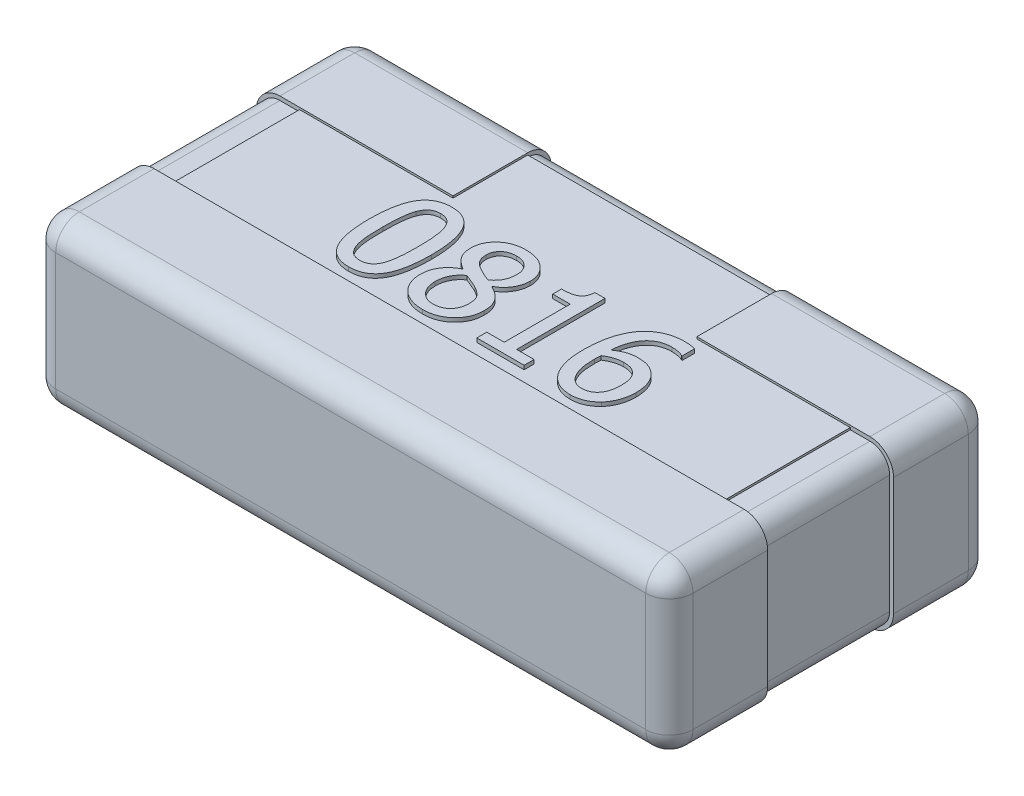
from build123d import *

# Parameters (mm, degrees)
SKETCH1_W           = 1.6
SKETCH1_H           = 0.8
BOSS_EXTRUDE1_DEPTH = 0.4
SKETCH2_W           = 1.62
SKETCH2_H           = 0.25
SKETCH2_W_2         = 0.5
BOSS_EXTRUDE2_DEPTH = 0.01
SKETCH3_W           = 1.62
SKETCH3_H           = 0.25
SKETCH3_W_2         = 0.5
BOSS_EXTRUDE3_DEPTH = 0.41
SKETCH4_W           = 1.4
SKETCH4_H           = 0.51
BOSS_EXTRUDE4_DEPTH = 0.005
FILLET1_R           = 0.05
FILLET2_R           = 0.06
WRAP1_DEPTH         = 0.01


# Read off the part's stored shape, not the designer's step: Wrap1
with BuildPart() as part:
    # Sketch1 → Boss-Extrude1 (new body)
    with BuildSketch(Plane(origin=(0, 0, 0), x_dir=(1, 0, 0), z_dir=(0, 1, 0))):
        Rectangle(SKETCH1_W, SKETCH1_H)
    extrude(amount=BOSS_EXTRUDE1_DEPTH)

    # Sketch2 → Boss-Extrude2 (add)
    with BuildSketch(Plane.XZ):
        with Locations((0, 0.285)):
            Rectangle(SKETCH2_W, SKETCH2_H)
        with Locations((0.56, -0.285)):
            Rectangle(SKETCH2_W_2, SKETCH2_H)
        with Locations((-0.56, -0.285)):
            Rectangle(SKETCH2_W_2, SKETCH2_H)
    extrude(amount=BOSS_EXTRUDE2_DEPTH)

    # Sketch3 → Boss-Extrude3 (add)
    with BuildSketch(Plane.XZ):
        with Locations((0, 0.285)):
            Rectangle(SKETCH3_W, SKETCH3_H)
        with Locations((-0.56, -0.285)):
            Rectangle(SKETCH3_W_2, SKETCH3_H)
        with Locations((0.56, -0.285)):
            Rectangle(SKETCH3_W_2, SKETCH3_H)
    extrude(amount=-BOSS_EXTRUDE3_DEPTH)

    # Sketch4 → Boss-Extrude4 (add)
    with BuildSketch(Plane(origin=(0, 0.4, 0), x_dir=(1, 0, 0), z_dir=(0, 1, 0))):
        with Locations((0, 0.095)):
            Rectangle(SKETCH4_W, SKETCH4_H)
    extrude(amount=BOSS_EXTRUDE4_DEPTH)

    # Fillet1
    fillet1_edges = [part.edges().sort_by_distance(p)[0] for p in [
        (0, 0, -0.4),
        (0.8, 0, 0),
        (0.8, 0.4, 0),
        (0, 0.4, -0.4),
        (-0.8, 0, 0),
        (-0.8, 0.4, 0),
    ]]
    fillet(fillet1_edges, radius=FILLET1_R - 0.0001)  # a hair under: the kernel refuses the full size

    # Fillet2
    fillet2_edges = [part.edges().sort_by_distance(p)[0] for p in [
        (-0.81, 0.2, 0.41),
        (0.81, 0.2, 0.41),
        (-0.81, -0.01, 0.285),
        (0.81, -0.01, 0.285),
        (0, -0.01, 0.41),
        (0.81, 0.2, -0.41),
        (0.81, -0.01, -0.285),
        (0.56, -0.01, -0.41),
        (-0.81, 0.2, -0.41),
        (-0.81, -0.01, -0.285),
        (-0.56, -0.01, -0.41),
        (-0.81, 0.41, 0.285),
        (0, 0.41, 0.41),
        (0.81, 0.41, 0.285),
        (-0.81, 0.41, -0.285),
        (-0.56, 0.41, -0.41),
        (0.81, 0.41, -0.285),
        (0.56, 0.41, -0.41),
    ]]
    fillet(fillet2_edges, radius=FILLET2_R)

    # Wrap1 outline → Wrap1 (add)
    # profile 1 of 4: a face of its own
    with BuildSketch(Plane(origin=(0, 0.405, 0), x_dir=(1, 0, 0), z_dir=(0, 1, 0))):
        with BuildLine():
            add(Edge.make_bspline(
                [(-0.28164557, -0.133758877), (-0.284948736, -0.133675329), (-0.291362335, -0.133513109), (-0.300623593, -0.131932714), (-0.309234826, -0.129437712), (-0.31713476, -0.125835647), (-0.324428073, -0.121318193), (-0.330935045, -0.115652211), (-0.336751827, -0.108994221), (-0.34195294, -0.101358474), (-0.346347397, -0.092604443), (-0.350273586, -0.082891965), (-0.353505311, -0.072090094), (-0.356137367, -0.060235555), (-0.358269096, -0.047330097), (-0.359702929, -0.03334383), (-0.360604641, -0.018313968), (-0.360706766, -0.007936154), (-0.360759494, -0.002578102)],
                knots=[0, 0, 0, 0, 0.057104334, 0.110876737, 0.162035925, 0.211809345, 0.260626803, 0.309961247, 0.360474986, 0.413230592, 0.469347354, 0.529609093, 0.594288864, 0.664161379, 0.739592893, 0.820463317, 0.90730544, 1, 1, 1, 1], degree=3))
            add(Edge.make_bspline(
                [(-0.202531646, -0.002281424), (-0.202585608, -0.007754656), (-0.202689871, -0.018329751), (-0.203570654, -0.033643728), (-0.205080187, -0.047821177), (-0.207188029, -0.060884232), (-0.209880565, -0.072818226), (-0.213154646, -0.083654787), (-0.217103227, -0.093345505), (-0.221651765, -0.101931286), (-0.22684583, -0.109465839), (-0.232687084, -0.115994361), (-0.239235701, -0.121497841), (-0.246449345, -0.125990901), (-0.254306962, -0.129534932), (-0.262851843, -0.131978827), (-0.272031506, -0.133500647), (-0.278375886, -0.133671055), (-0.28164557, -0.133758877)],
                knots=[0, 0, 0, 0, 0.094505454, 0.182598569, 0.264756325, 0.340602223, 0.410956387, 0.475865224, 0.53585284, 0.591368281, 0.643316935, 0.693496087, 0.742180783, 0.790510626, 0.839810374, 0.890516237, 0.94357569, 1, 1, 1, 1], degree=3))
            add(Edge.make_bspline(
                [(-0.28164557, 0.128899351), (-0.278343105, 0.128813852), (-0.271930869, 0.128647841), (-0.26265532, 0.127093383), (-0.254073825, 0.124501457), (-0.246113431, 0.120972609), (-0.238952605, 0.116220562), (-0.23237127, 0.110585466), (-0.226528871, 0.103861717), (-0.221423329, 0.096077806), (-0.216922424, 0.087341505), (-0.213089351, 0.077549783), (-0.209779355, 0.066777459), (-0.207157423, 0.05492979), (-0.205024395, 0.042091738), (-0.203590001, 0.028204129), (-0.202686024, 0.013306269), (-0.202584221, 0.003027211), (-0.202531646, -0.002281424)],
                knots=[0, 0, 0, 0, 0.057159651, 0.110984143, 0.162274764, 0.212096399, 0.261182409, 0.310564644, 0.361744742, 0.414866044, 0.471421686, 0.531635674, 0.596734526, 0.666396332, 0.741619286, 0.822000391, 0.908071825, 1, 1, 1, 1], degree=3))
            add(Edge.make_bspline(
                [(-0.360759494, -0.002578102), (-0.360705418, 0.002928048), (-0.360601077, 0.013552477), (-0.359725233, 0.028916574), (-0.358199559, 0.043141125), (-0.356120492, 0.05622542), (-0.35340713, 0.068173259), (-0.350120804, 0.078979677), (-0.34625943, 0.088684015), (-0.341676883, 0.097242869), (-0.336456162, 0.10473578), (-0.330605841, 0.111240495), (-0.324037682, 0.116680697), (-0.316856108, 0.121194601), (-0.308970335, 0.124661305), (-0.300441386, 0.127123825), (-0.291259061, 0.128639884), (-0.284915059, 0.128811108), (-0.28164557, 0.128899351)],
                knots=[0, 0, 0, 0, 0.095033481, 0.183372521, 0.265494763, 0.341869445, 0.411915871, 0.47679665, 0.536650935, 0.591891687, 0.643980504, 0.693926951, 0.742408152, 0.790717104, 0.839879619, 0.890563563, 0.943600081, 1, 1, 1, 1], degree=3))
        make_face()
        with BuildLine():
            add(Edge.make_bspline(
                [(-0.237341772, -0.002281424), (-0.237349138, 0.001872557), (-0.237363405, 0.009918887), (-0.237801069, 0.021555914), (-0.238336724, 0.032361258), (-0.239256156, 0.042317349), (-0.240317583, 0.051475125), (-0.24187292, 0.059805813), (-0.243688266, 0.067359989), (-0.245316214, 0.072030555), (-0.24609375, 0.074261297)],
                knots=[0, 0, 0, 0, 0.160979312, 0.311819558, 0.451285869, 0.580195806, 0.699281131, 0.808409006, 0.908492833, 1, 1, 1, 1], degree=3))
            add(Edge.make_bspline(
                [(-0.245945411, -0.078824146), (-0.245184924, -0.076609596), (-0.243591765, -0.071970291), (-0.241815483, -0.064451156), (-0.240337818, -0.056147092), (-0.239247364, -0.047013394), (-0.238336759, -0.037055742), (-0.237802166, -0.026234144), (-0.237362134, -0.01454767), (-0.237348723, -0.006468373), (-0.237341772, -0.002281424)],
                knots=[0, 0, 0, 0, 0.090738379, 0.190089623, 0.299148368, 0.417648681, 0.5466118, 0.686773738, 0.837676214, 1, 1, 1, 1], degree=3))
            add(Edge.make_bspline(
                [(-0.28164557, -0.105277864), (-0.279494494, -0.105219937), (-0.275347842, -0.105108269), (-0.269460309, -0.103748807), (-0.264097144, -0.101765602), (-0.259366601, -0.098769437), (-0.25522641, -0.094920749), (-0.251538963, -0.090338205), (-0.248396557, -0.084903383), (-0.246785352, -0.080907334), (-0.245945411, -0.078824146)],
                knots=[0, 0, 0, 0, 0.134618973, 0.259506357, 0.376975276, 0.491683515, 0.608000929, 0.730032873, 0.859262861, 1, 1, 1, 1], degree=3))
            add(Edge.make_bspline(
                [(-0.317691851, -0.078280238), (-0.316869426, -0.080347669), (-0.315279191, -0.084345243), (-0.312139574, -0.089760964), (-0.308536809, -0.094455724), (-0.304418916, -0.098431853), (-0.299634428, -0.101564139), (-0.294191256, -0.103744696), (-0.288117309, -0.105037725), (-0.283860766, -0.105195667), (-0.28164557, -0.105277864)],
                knots=[0, 0, 0, 0, 0.137453356, 0.265778963, 0.385661764, 0.502458594, 0.618088746, 0.73695762, 0.863107124, 1, 1, 1, 1], degree=3))
            add(Edge.make_bspline(
                [(-0.325949367, -0.002578102), (-0.325934185, -0.006781318), (-0.325905125, -0.014826276), (-0.325583051, -0.026364148), (-0.325188255, -0.036837205), (-0.324488253, -0.046336222), (-0.323556816, -0.05508434), (-0.322023837, -0.063242609), (-0.32023073, -0.07099186), (-0.318525713, -0.075886465), (-0.317691851, -0.078280238)],
                knots=[0, 0, 0, 0, 0.164745308, 0.315322565, 0.452406442, 0.575486842, 0.688637968, 0.796982196, 0.900711383, 1, 1, 1, 1], degree=3))
            add(Edge.make_bspline(
                [(-0.317494066, 0.07396462), (-0.318296063, 0.071703112), (-0.319976637, 0.06696415), (-0.321715467, 0.059225191), (-0.323210329, 0.050697057), (-0.324244911, 0.041346054), (-0.32502403, 0.031285419), (-0.32554188, 0.020550412), (-0.325910806, 0.009192683), (-0.325936299, 0.001410885), (-0.325949367, -0.002578102)],
                knots=[0, 0, 0, 0, 0.0929667, 0.194810628, 0.307025212, 0.428630891, 0.559407911, 0.698270924, 0.845332245, 1, 1, 1, 1], degree=3))
            add(Edge.make_bspline(
                [(-0.28164557, 0.100418338), (-0.283796107, 0.100358922), (-0.287941718, 0.100244385), (-0.293842366, 0.09890352), (-0.299185522, 0.096847202), (-0.303906857, 0.093860457), (-0.30808666, 0.090065592), (-0.31173748, 0.085448951), (-0.315007744, 0.08006597), (-0.316643465, 0.076051968), (-0.317494066, 0.07396462)],
                knots=[0, 0, 0, 0, 0.134464579, 0.25920873, 0.376919294, 0.491495975, 0.606985299, 0.728877285, 0.859011665, 1, 1, 1, 1], degree=3))
            add(Edge.make_bspline(
                [(-0.24609375, 0.074261297), (-0.246938158, 0.076293116), (-0.248568445, 0.080215925), (-0.2516719, 0.085562942), (-0.255338085, 0.090050526), (-0.259374336, 0.093860025), (-0.264026657, 0.096870026), (-0.269351639, 0.098899868), (-0.275282375, 0.100252597), (-0.279461686, 0.100361455), (-0.28164557, 0.100418338)],
                knots=[0, 0, 0, 0, 0.138940491, 0.268250711, 0.388932201, 0.503892906, 0.617711156, 0.736449368, 0.862282573, 1, 1, 1, 1], degree=3))
        make_face(mode=Mode.SUBTRACT)
    # profile 2 of 4: a face of its own
    with BuildSketch(Plane(origin=(0, 0.405, 0), x_dir=(1, 0, 0), z_dir=(0, 1, 0))):
        with BuildLine():
            add(Edge.make_bspline(
                [(-0.15273932, -0.112150886), (-0.154433577, -0.110427011), (-0.157798347, -0.107003421), (-0.162039838, -0.101147196), (-0.165803436, -0.094932704), (-0.16877499, -0.088180636), (-0.17115357, -0.081131982), (-0.172833218, -0.073827968), (-0.173843199, -0.066326179), (-0.173981064, -0.061257356), (-0.174050633, -0.058699541)],
                knots=[0, 0, 0, 0, 0.122480314, 0.243244073, 0.365872764, 0.49052655, 0.616675053, 0.742856816, 0.870241178, 1, 1, 1, 1], degree=3))
            add(Edge.make_bspline(
                [(-0.09335443, -0.133758877), (-0.096373803, -0.133695794), (-0.102282775, -0.13357234), (-0.110935401, -0.132505225), (-0.119164058, -0.130792334), (-0.126956036, -0.128378819), (-0.134235615, -0.125254396), (-0.140988698, -0.121526425), (-0.147253975, -0.117256167), (-0.150916516, -0.113847393), (-0.15273932, -0.112150886)],
                knots=[0, 0, 0, 0, 0.139696008, 0.273387821, 0.402797975, 0.528256174, 0.650253049, 0.768724326, 0.884896801, 1, 1, 1, 1], degree=3))
            add(Edge.make_bspline(
                [(-0.012658228, -0.058007295), (-0.012719305, -0.060648011), (-0.012839332, -0.065837447), (-0.013946906, -0.073448909), (-0.015814609, -0.080700241), (-0.018242159, -0.087686554), (-0.02157382, -0.094280703), (-0.02552352, -0.100603876), (-0.03026271, -0.106545458), (-0.035633227, -0.112099398), (-0.041518185, -0.11718525), (-0.047880658, -0.121569459), (-0.054537789, -0.125386852), (-0.061604069, -0.128455738), (-0.069044048, -0.130834201), (-0.076847994, -0.132488755), (-0.084984176, -0.133572789), (-0.090532444, -0.133696138), (-0.09335443, -0.133758877)],
                knots=[0, 0, 0, 0, 0.06405392, 0.125876317, 0.186115612, 0.245573111, 0.304956577, 0.364988389, 0.426202323, 0.48899644, 0.552246168, 0.614599305, 0.676213058, 0.738184055, 0.801174018, 0.865422435, 0.931550516, 1, 1, 1, 1], degree=3))
            add(Edge.make_bspline(
                [(-0.055923655, 0.004739936), (-0.05255803, 0.002991118), (-0.04606332, -0.000383611), (-0.037232098, -0.006317762), (-0.029745065, -0.012888343), (-0.024475449, -0.018875911), (-0.020999081, -0.024009294), (-0.0187483, -0.028091649), (-0.016910078, -0.032451372), (-0.01526689, -0.037036034), (-0.014124911, -0.04191871), (-0.013292865, -0.047057827), (-0.012712162, -0.052439658), (-0.012676445, -0.056126758), (-0.012658228, -0.058007295)],
                knots=[0, 0, 0, 0, 0.140035604, 0.270229333, 0.391879088, 0.507114859, 0.563683414, 0.620630752, 0.67898933, 0.738292998, 0.800312764, 0.863870382, 0.930569644, 1, 1, 1, 1], degree=3))
            Line((-0.055923655, 0.004739936), (-0.055923655, 0.00572886))
            add(Edge.make_bspline(
                [(-0.018987342, 0.064965411), (-0.019103527, 0.062154553), (-0.019337512, 0.056493766), (-0.021206596, 0.048034684), (-0.024278047, 0.039658578), (-0.028375561, 0.031395073), (-0.033612395, 0.023615163), (-0.04000485, 0.016635463), (-0.047439587, 0.010539867), (-0.053069695, 0.007347237), (-0.055923655, 0.00572886)],
                knots=[0, 0, 0, 0, 0.115000077, 0.231598587, 0.352839762, 0.479585745, 0.608350839, 0.735401824, 0.865872467, 1, 1, 1, 1], degree=3))
            add(Edge.make_bspline(
                [(-0.093255538, 0.128899351), (-0.090517134, 0.128842314), (-0.085175356, 0.128731053), (-0.077374111, 0.127866367), (-0.069971509, 0.126511834), (-0.06299087, 0.124525807), (-0.056406038, 0.122004985), (-0.050261575, 0.118883037), (-0.044539082, 0.115193415), (-0.039256341, 0.111017484), (-0.034537799, 0.106362251), (-0.030321866, 0.101430178), (-0.026867632, 0.096079376), (-0.023968697, 0.09047765), (-0.021719759, 0.084538806), (-0.020173091, 0.078278576), (-0.01912164, 0.071725428), (-0.019032613, 0.067244177), (-0.018987342, 0.064965411)],
                knots=[0, 0, 0, 0, 0.074658982, 0.145636577, 0.21377824, 0.279652799, 0.343255672, 0.40576932, 0.467233612, 0.528653519, 0.589041865, 0.647740644, 0.705209965, 0.762298387, 0.819480506, 0.877910228, 0.937916005, 1, 1, 1, 1], degree=3))
            add(Edge.make_bspline(
                [(-0.167721519, 0.062740332), (-0.167655613, 0.065068338), (-0.167526457, 0.06963053), (-0.16649089, 0.076319633), (-0.164905793, 0.082723699), (-0.162506804, 0.088787149), (-0.159641383, 0.09463879), (-0.155886789, 0.100063517), (-0.151661507, 0.105314727), (-0.146687829, 0.110098469), (-0.141325035, 0.114546751), (-0.135469012, 0.118373557), (-0.129293064, 0.121629039), (-0.122769527, 0.124348597), (-0.115871803, 0.126328164), (-0.108653848, 0.127836652), (-0.101074237, 0.128735125), (-0.095895057, 0.12884391), (-0.093255538, 0.128899351)],
                knots=[0, 0, 0, 0, 0.062679855, 0.122833695, 0.181952915, 0.24000041, 0.298178502, 0.357040413, 0.417300663, 0.479465769, 0.542568771, 0.60475607, 0.667516071, 0.730426658, 0.794770155, 0.86051234, 0.928911482, 1, 1, 1, 1], degree=3))
            add(Edge.make_bspline(
                [(-0.132070807, 0.007063908), (-0.134945826, 0.008851959), (-0.140452509, 0.012276712), (-0.147768355, 0.018144095), (-0.154014065, 0.024134224), (-0.15911768, 0.030526956), (-0.163012547, 0.037522268), (-0.165796583, 0.045226444), (-0.167436722, 0.053738064), (-0.167624299, 0.059667273), (-0.167721519, 0.062740332)],
                knots=[0, 0, 0, 0, 0.14548206, 0.278649813, 0.402454762, 0.517028588, 0.629039254, 0.745187416, 0.867932756, 1, 1, 1, 1], degree=3))
            Line((-0.132070807, 0.007063908), (-0.132070807, 0.006074984))
            add(Edge.make_bspline(
                [(-0.174050633, -0.058699541), (-0.173912173, -0.055360794), (-0.173638264, -0.048755912), (-0.171609733, -0.039049957), (-0.168206033, -0.029789125), (-0.164309886, -0.022469153), (-0.160491235, -0.016993501), (-0.157376789, -0.012995505), (-0.153911639, -0.009252088), (-0.150148921, -0.005724871), (-0.146048476, -0.002468206), (-0.141711759, 0.000675381), (-0.137019565, 0.0035269), (-0.133729533, 0.005220916), (-0.132070807, 0.006074984)],
                knots=[0, 0, 0, 0, 0.122814983, 0.2429589, 0.363078318, 0.484921917, 0.546836548, 0.608599474, 0.671270053, 0.734353125, 0.79819848, 0.863842247, 0.931353715, 1, 1, 1, 1], degree=3))
        make_face()
        with BuildLine():
            add(Edge.make_bspline(
                [(-0.076344937, -0.018054763), (-0.077346609, -0.017503866), (-0.079491549, -0.016324197), (-0.082979227, -0.01460358), (-0.086973752, -0.01288424), (-0.09309157, -0.010392934), (-0.101615781, -0.006934808), (-0.108589859, -0.003927447), (-0.112292326, -0.002330871)],
                knots=[0, 0, 0, 0, 0.087356195, 0.187061063, 0.297047996, 0.419614903, 0.691879503, 1, 1, 1, 1], degree=3))
            add(Edge.make_bspline(
                [(-0.047468354, -0.061122405), (-0.047518884, -0.058677794), (-0.047615444, -0.054006218), (-0.04876671, -0.047423743), (-0.05056756, -0.04159356), (-0.053281863, -0.036418279), (-0.057187751, -0.031693868), (-0.06229245, -0.02706222), (-0.068792291, -0.022422171), (-0.073713504, -0.019576421), (-0.076344937, -0.018054763)],
                knots=[0, 0, 0, 0, 0.13244625, 0.253100626, 0.36108972, 0.462259392, 0.567801099, 0.691793555, 0.835198211, 1, 1, 1, 1], degree=3))
            add(Edge.make_bspline(
                [(-0.09271163, -0.108442421), (-0.091045103, -0.108406217), (-0.087783475, -0.10833536), (-0.083016752, -0.107728696), (-0.078495586, -0.106746219), (-0.074232016, -0.105368925), (-0.07021539, -0.10356771), (-0.066480534, -0.101343143), (-0.062976038, -0.098750445), (-0.059772074, -0.095773337), (-0.056842652, -0.092493062), (-0.054366506, -0.088827673), (-0.052233938, -0.08490217), (-0.050440991, -0.080707839), (-0.049107803, -0.076207899), (-0.04819216, -0.071436403), (-0.047570585, -0.066379893), (-0.047503005, -0.062904419), (-0.047468354, -0.061122405)],
                knots=[0, 0, 0, 0, 0.067576948, 0.132257661, 0.194548152, 0.25501447, 0.313664657, 0.372713585, 0.431012159, 0.490151849, 0.549836964, 0.608991768, 0.669124528, 0.73083831, 0.793657543, 0.859083731, 0.927746599, 1, 1, 1, 1], degree=3))
            add(Edge.make_bspline(
                [(-0.139240506, -0.056078893), (-0.139207847, -0.057926889), (-0.139143488, -0.0615686), (-0.13847843, -0.066893152), (-0.137445405, -0.071971772), (-0.136009208, -0.076811505), (-0.134139583, -0.08140133), (-0.131825085, -0.085737896), (-0.129181154, -0.089867299), (-0.126049839, -0.093636991), (-0.122668157, -0.097110914), (-0.118995684, -0.100106655), (-0.115174994, -0.102739292), (-0.111073731, -0.104812189), (-0.106784123, -0.106451834), (-0.102268705, -0.107587174), (-0.097563292, -0.108295374), (-0.094345888, -0.108392889), (-0.09271163, -0.108442421)],
                knots=[0, 0, 0, 0, 0.07075454, 0.139430846, 0.205177594, 0.269095336, 0.332521673, 0.394652811, 0.457167675, 0.519978315, 0.582032423, 0.642578023, 0.701237794, 0.759402854, 0.818147499, 0.876793679, 0.937418225, 1, 1, 1, 1], degree=3))
            add(Edge.make_bspline(
                [(-0.112292326, -0.002330871), (-0.114395495, -0.003911771), (-0.118541195, -0.007027991), (-0.12395674, -0.01253734), (-0.128591801, -0.018572632), (-0.132477322, -0.025116911), (-0.13549486, -0.032187531), (-0.137689858, -0.039718907), (-0.138987028, -0.047743625), (-0.139154651, -0.053255675), (-0.139240506, -0.056078893)],
                knots=[0, 0, 0, 0, 0.125912547, 0.248194857, 0.368702539, 0.489772898, 0.611810204, 0.736005029, 0.864784405, 1, 1, 1, 1], degree=3))
        make_face(mode=Mode.SUBTRACT)
        with BuildLine():
            add(Edge.make_bspline(
                [(-0.092167722, 0.103582895), (-0.093619691, 0.103559441), (-0.096482983, 0.103513191), (-0.100665073, 0.102999492), (-0.104651725, 0.102215184), (-0.108423045, 0.101121994), (-0.112013883, 0.099748188), (-0.115378155, 0.097996395), (-0.118574451, 0.095968177), (-0.121515612, 0.093603821), (-0.124187298, 0.0909904), (-0.126537364, 0.088149027), (-0.128542495, 0.085075976), (-0.13009472, 0.08172436), (-0.131412502, 0.078217163), (-0.132302357, 0.074464119), (-0.132776328, 0.070499185), (-0.132865743, 0.067785036), (-0.132911392, 0.066399351)],
                knots=[0, 0, 0, 0, 0.070107137, 0.138251692, 0.203209895, 0.266206117, 0.327715554, 0.388608664, 0.449125822, 0.51030456, 0.570548739, 0.629371324, 0.68811842, 0.747236639, 0.807438711, 0.868850157, 0.933042617, 1, 1, 1, 1], degree=3))
            add(Edge.make_bspline(
                [(-0.050632911, 0.06432261), (-0.050650901, 0.065693026), (-0.050686381, 0.068395882), (-0.051280348, 0.072342355), (-0.052073148, 0.076137457), (-0.053356448, 0.079709615), (-0.054881992, 0.083146873), (-0.056755413, 0.086435177), (-0.059055782, 0.089483252), (-0.061619449, 0.092363696), (-0.064495138, 0.094989929), (-0.067644497, 0.097322826), (-0.071094682, 0.099251583), (-0.074785964, 0.100853625), (-0.078752051, 0.102072343), (-0.082984513, 0.102981833), (-0.08749298, 0.103447135), (-0.090584564, 0.103536918), (-0.092167722, 0.103582895)],
                knots=[0, 0, 0, 0, 0.063839361, 0.125909688, 0.185770463, 0.244354275, 0.302497733, 0.361036145, 0.420376489, 0.480252068, 0.540643464, 0.601677134, 0.662599379, 0.724569681, 0.788994039, 0.855777919, 0.926145862, 1, 1, 1, 1], degree=3))
            add(Edge.make_bspline(
                [(-0.07525712, 0.014184161), (-0.07300294, 0.016013066), (-0.068700473, 0.019503828), (-0.063244369, 0.025294774), (-0.058820434, 0.031078727), (-0.055665093, 0.037135741), (-0.053342298, 0.043389056), (-0.051812669, 0.050007307), (-0.05076091, 0.057020412), (-0.05067632, 0.061846156), (-0.050632911, 0.06432261)],
                knots=[0, 0, 0, 0, 0.149369782, 0.285096337, 0.408884634, 0.523203337, 0.635492572, 0.751634785, 0.872545021, 1, 1, 1, 1], degree=3))
            add(Edge.make_bspline(
                [(-0.109671677, 0.030056392), (-0.108719185, 0.029522469), (-0.106602705, 0.028336069), (-0.103031918, 0.026540387), (-0.098831041, 0.024410406), (-0.092570496, 0.021252297), (-0.084705084, 0.017627827), (-0.078272194, 0.015283118), (-0.07525712, 0.014184161)],
                knots=[0, 0, 0, 0, 0.086331476, 0.191832323, 0.315979042, 0.458775337, 0.746329769, 1, 1, 1, 1], degree=3))
            add(Edge.make_bspline(
                [(-0.132911392, 0.066399351), (-0.132855818, 0.064399256), (-0.132748806, 0.060547981), (-0.131617629, 0.055000096), (-0.129812697, 0.049936057), (-0.127219844, 0.045319105), (-0.123864675, 0.041121874), (-0.119835992, 0.037149893), (-0.115035264, 0.033443404), (-0.111504357, 0.031213697), (-0.109671677, 0.030056392)],
                knots=[0, 0, 0, 0, 0.131717783, 0.253628776, 0.371545957, 0.484913276, 0.601008511, 0.724732175, 0.857125197, 1, 1, 1, 1], degree=3))
        make_face(mode=Mode.SUBTRACT)
    # profile 3 of 4: a face of its own
    with BuildSketch(Plane(origin=(0, 0.405, 0), x_dir=(1, 0, 0), z_dir=(0, 1, 0))):
        with BuildLine():
            add(Edge.make_bspline(
                [(0.037974684, 0.08776011), (0.040002481, 0.08777406), (0.043912991, 0.087800962), (0.049573829, 0.088147494), (0.054820029, 0.088741419), (0.059656057, 0.089526002), (0.064102978, 0.090478751), (0.068107453, 0.091785706), (0.071723531, 0.093248294), (0.074970599, 0.094938509), (0.077837263, 0.096982425), (0.080328413, 0.099453987), (0.082544488, 0.102292806), (0.084335263, 0.105590241), (0.085905516, 0.109235538), (0.087071875, 0.113324161), (0.087896256, 0.117814651), (0.088202436, 0.120951998), (0.088360364, 0.122570237)],
                knots=[0, 0, 0, 0, 0.086954406, 0.167687411, 0.243092423, 0.313281177, 0.377759961, 0.437892337, 0.493680009, 0.544906126, 0.59453707, 0.644021826, 0.694920147, 0.748403278, 0.804463446, 0.864856989, 0.930293403, 1, 1, 1, 1], degree=3))
            Line((0.037974684, 0.08776011), (0.037974684, 0.065608212))
            Line((0.037974684, 0.065608212), (0.082278481, 0.065608212))
            Line((0.082278481, 0.065608212), (0.082278481, -0.102113307))
            Line((0.082278481, -0.102113307), (0.037974684, -0.102113307))
            Line((0.037974684, -0.102113307), (0.037974684, -0.127429763))
            Line((0.037974684, -0.127429763), (0.158227848, -0.127429763))
            Line((0.158227848, -0.127429763), (0.158227848, -0.102113307))
            Line((0.158227848, -0.102113307), (0.113924051, -0.102113307))
            Line((0.113924051, -0.102113307), (0.113924051, 0.122570237))
            Line((0.113924051, 0.122570237), (0.088360364, 0.122570237))
        make_face()
    # profile 4 of 4: a face of its own
    with BuildSketch(Plane(origin=(0, 0.405, 0), x_dir=(1, 0, 0), z_dir=(0, 1, 0))):
        with BuildLine():
            add(Edge.make_bspline(
                [(0.33737144, -0.109826915), (0.335497116, -0.111714009), (0.331785603, -0.115450811), (0.325625331, -0.120275617), (0.319151713, -0.124415803), (0.31236254, -0.127867292), (0.305198545, -0.130476937), (0.297696793, -0.132375717), (0.289839731, -0.133526289), (0.284467828, -0.133680631), (0.281744462, -0.133758877)],
                knots=[0, 0, 0, 0, 0.127875064, 0.253216713, 0.375533843, 0.497183294, 0.618871513, 0.741586482, 0.868993453, 1, 1, 1, 1], degree=3))
            add(Edge.make_bspline(
                [(0.360759494, -0.045991867), (0.360686358, -0.049209597), (0.360542944, -0.055519388), (0.359326178, -0.06480919), (0.357308619, -0.073695859), (0.35451875, -0.082152858), (0.35117227, -0.090097637), (0.347101212, -0.09733522), (0.342658547, -0.104018111), (0.339119859, -0.107905974), (0.33737144, -0.109826915)],
                knots=[0, 0, 0, 0, 0.138619054, 0.271824407, 0.402947537, 0.530750655, 0.65516343, 0.773752909, 0.888214326, 1, 1, 1, 1], degree=3))
            add(Edge.make_bspline(
                [(0.333959652, 0.018930997), (0.336121387, 0.01710679), (0.340419881, 0.013479454), (0.345943649, 0.007062241), (0.350562462, -7.3699e-05), (0.354335576, -0.007901497), (0.357261408, -0.016433858), (0.359304876, -0.025671884), (0.36056198, -0.035606363), (0.360692339, -0.042460818), (0.360759494, -0.045991867)],
                knots=[0, 0, 0, 0, 0.116355603, 0.231366816, 0.347162661, 0.465569476, 0.588364658, 0.717806101, 0.854628781, 1, 1, 1, 1], degree=3))
            add(Edge.make_bspline(
                [(0.286145174, 0.033962642), (0.288470139, 0.033922361), (0.292978332, 0.033844254), (0.299521617, 0.033309681), (0.30562183, 0.032380029), (0.311390778, 0.031037835), (0.317010112, 0.029129313), (0.322610787, 0.026461787), (0.328346724, 0.023081395), (0.332038974, 0.020351214), (0.333959652, 0.018930997)],
                knots=[0, 0, 0, 0, 0.136193537, 0.264084361, 0.384252243, 0.497366898, 0.610646263, 0.731155004, 0.860149044, 1, 1, 1, 1], degree=3))
            add(Edge.make_bspline(
                [(0.234869462, 0.016211455), (0.236827396, 0.01759367), (0.240675256, 0.020310087), (0.246720697, 0.023809464), (0.252773491, 0.026902447), (0.258975956, 0.029441671), (0.265355147, 0.031524708), (0.272035596, 0.032929514), (0.279002455, 0.033788249), (0.283736271, 0.033903827), (0.286145174, 0.033962642)],
                knots=[0, 0, 0, 0, 0.13010657, 0.255693881, 0.378998445, 0.499022904, 0.619340773, 0.742947169, 0.869193168, 1, 1, 1, 1], degree=3))
            add(Edge.make_bspline(
                [(0.306418117, 0.100418338), (0.3039259, 0.100351548), (0.299053089, 0.10022096), (0.291946741, 0.099209769), (0.285197434, 0.097579798), (0.278798076, 0.095267289), (0.272803005, 0.092215472), (0.267142854, 0.08858543), (0.261882126, 0.084240182), (0.256978226, 0.079246095), (0.252540075, 0.073570203), (0.248477646, 0.067317437), (0.245054935, 0.060332965), (0.242036387, 0.052743428), (0.23947418, 0.044528567), (0.237403729, 0.035671396), (0.235816311, 0.026173658), (0.235191073, 0.01959526), (0.234869462, 0.016211455)],
                knots=[0, 0, 0, 0, 0.060601639, 0.118489017, 0.17420469, 0.229247037, 0.283572228, 0.337505474, 0.392482081, 0.449181418, 0.507410685, 0.567462158, 0.630213686, 0.696247467, 0.765986469, 0.839307125, 0.917342606, 1, 1, 1, 1], degree=3))
            add(Edge.make_bspline(
                [(0.337124209, 0.094089224), (0.336308031, 0.094503371), (0.334551405, 0.095394722), (0.331552053, 0.096412079), (0.328129658, 0.097549617), (0.322798374, 0.0988279), (0.315527893, 0.100175475), (0.30950814, 0.100335959), (0.306418117, 0.100418338)],
                knots=[0, 0, 0, 0, 0.086784693, 0.186783042, 0.300107254, 0.429141331, 0.70697029, 1, 1, 1, 1], degree=3))
            Line((0.337124209, 0.094089224), (0.338607595, 0.094089224))
            Line((0.338607595, 0.094089224), (0.338607595, 0.125438117))
            add(Edge.make_bspline(
                [(0.310472706, 0.128899351), (0.313161481, 0.128872087), (0.318333118, 0.128819647), (0.325755168, 0.128125263), (0.332512414, 0.127238849), (0.336656981, 0.126014397), (0.338607595, 0.125438117)],
                knots=[0, 0, 0, 0, 0.28334731, 0.544995023, 0.785854891, 1, 1, 1, 1], degree=3))
            add(Edge.make_bspline(
                [(0.226463608, 0.08815568), (0.228796727, 0.09123376), (0.233448447, 0.097370764), (0.241729734, 0.10546302), (0.251036435, 0.11240293), (0.259454244, 0.117372298), (0.266650905, 0.120711977), (0.272310487, 0.122876404), (0.278161056, 0.124775559), (0.284221328, 0.126305955), (0.2905049, 0.127429477), (0.296973934, 0.128256087), (0.303654886, 0.128843848), (0.308180397, 0.12888069), (0.310472706, 0.128899351)],
                knots=[0, 0, 0, 0, 0.119075983, 0.237410936, 0.355823477, 0.476646548, 0.538318476, 0.600473047, 0.663528516, 0.728048182, 0.793196349, 0.860387457, 0.929281993, 1, 1, 1, 1], degree=3))
            add(Edge.make_bspline(
                [(0.199367089, -0.017510855), (0.199427301, -0.012150914), (0.199544763, -0.001694876), (0.200916515, 0.013584228), (0.202855426, 0.028085246), (0.205779162, 0.041789464), (0.209569934, 0.054656571), (0.214215547, 0.066703725), (0.219776164, 0.077899826), (0.224253973, 0.084766987), (0.226463608, 0.08815568)],
                knots=[0, 0, 0, 0, 0.145125014, 0.283106241, 0.415176748, 0.541167699, 0.662215446, 0.778108479, 0.890504636, 1, 1, 1, 1], degree=3))
            add(Edge.make_bspline(
                [(0.226760285, -0.110865285), (0.224666782, -0.108426564), (0.220366205, -0.103416823), (0.215014778, -0.094694092), (0.210383602, -0.084858186), (0.207073607, -0.075900163), (0.204893163, -0.068127135), (0.203412088, -0.061875072), (0.202100368, -0.055302188), (0.201155102, -0.048378323), (0.200356595, -0.041140617), (0.199761078, -0.033572632), (0.199410773, -0.025656394), (0.199381852, -0.02026372), (0.199367089, -0.017510855)],
                knots=[0, 0, 0, 0, 0.096776885, 0.198803873, 0.307268689, 0.424230192, 0.486206997, 0.55056824, 0.617908639, 0.688182727, 0.76116635, 0.837427498, 0.917009605, 1, 1, 1, 1], degree=3))
            add(Edge.make_bspline(
                [(0.281744462, -0.133758877), (0.278987729, -0.133701649), (0.273599976, -0.133589804), (0.265707569, -0.132439563), (0.258188204, -0.130706764), (0.25105433, -0.128165611), (0.244365069, -0.124868748), (0.238025694, -0.12095003), (0.232100662, -0.116287105), (0.228552847, -0.112685184), (0.226760285, -0.110865285)],
                knots=[0, 0, 0, 0, 0.134681361, 0.263220879, 0.389085812, 0.511419285, 0.632501798, 0.753017276, 0.875210024, 1, 1, 1, 1], degree=3))
        make_face()
        with BuildLine():
            add(Edge.make_bspline(
                [(0.309285997, -0.003319795), (0.308218677, -0.002466608), (0.30609452, -0.000768612), (0.302560776, 0.001249825), (0.298804014, 0.002810577), (0.293515266, 0.004197487), (0.286650088, 0.005271231), (0.281089507, 0.005411061), (0.278283228, 0.005481629)],
                knots=[0, 0, 0, 0, 0.124300229, 0.247379745, 0.369207822, 0.493761615, 0.744514772, 1, 1, 1, 1], degree=3))
            add(Edge.make_bspline(
                [(0.325949367, -0.047277469), (0.325908447, -0.044786236), (0.325829931, -0.040006091), (0.325055638, -0.033149841), (0.323940661, -0.026903372), (0.322181972, -0.021262056), (0.31987144, -0.016133519), (0.317010445, -0.011397717), (0.313449318, -0.007095061), (0.310686255, -0.004589538), (0.309285997, -0.003319795)],
                knots=[0, 0, 0, 0, 0.153413335, 0.294367461, 0.42461141, 0.54376288, 0.657381725, 0.770404595, 0.883646201, 1, 1, 1, 1], degree=3))
            add(Edge.make_bspline(
                [(0.282041139, -0.105277864), (0.283641727, -0.105223355), (0.286773447, -0.105116701), (0.291357169, -0.104487372), (0.295705927, -0.103339419), (0.299796784, -0.101707689), (0.303662751, -0.099632476), (0.307344497, -0.097192565), (0.310707702, -0.094158488), (0.313884942, -0.090758651), (0.316764438, -0.086894531), (0.319244112, -0.082558368), (0.32131364, -0.077757101), (0.323055273, -0.072536234), (0.324292192, -0.066825009), (0.325314868, -0.060725682), (0.325826849, -0.054142662), (0.325907587, -0.049618597), (0.325949367, -0.047277469)],
                knots=[0, 0, 0, 0, 0.058451585, 0.114366701, 0.168521538, 0.22227363, 0.27477138, 0.328516734, 0.383091253, 0.439727136, 0.498222077, 0.558608809, 0.621668165, 0.688845815, 0.759212061, 0.834799009, 0.914511255, 1, 1, 1, 1], degree=3))
            add(Edge.make_bspline(
                [(0.251483386, -0.090889019), (0.252652383, -0.092125648), (0.2549046, -0.094508166), (0.258453777, -0.097686778), (0.262149838, -0.100140021), (0.265849985, -0.102156866), (0.269729296, -0.10349529), (0.273684407, -0.104574349), (0.277820583, -0.105163179), (0.280622035, -0.105239303), (0.282041139, -0.105277864)],
                knots=[0, 0, 0, 0, 0.146144417, 0.281565212, 0.40797951, 0.526381654, 0.642356005, 0.759430804, 0.87813715, 1, 1, 1, 1], degree=3))
            add(Edge.make_bspline(
                [(0.234177215, -0.024284984), (0.234222577, -0.028440687), (0.234308932, -0.036351844), (0.23526053, -0.047581527), (0.236716291, -0.057567259), (0.238904523, -0.066314496), (0.241597692, -0.073891809), (0.244515434, -0.080508419), (0.247695043, -0.086188909), (0.250271438, -0.089385384), (0.251483386, -0.090889019)],
                knots=[0, 0, 0, 0, 0.177608261, 0.338110609, 0.481408672, 0.608550492, 0.722870895, 0.824745196, 0.917559374, 1, 1, 1, 1], degree=3))
            add(Edge.make_bspline(
                [(0.234869462, -0.008363307), (0.234770158, -0.009582863), (0.234574318, -0.011987979), (0.234280172, -0.015693325), (0.234218872, -0.019785365), (0.234192015, -0.022686342), (0.234177215, -0.024284984)],
                knots=[0, 0, 0, 0, 0.230248415, 0.454078893, 0.699159116, 1, 1, 1, 1], degree=3))
            add(Edge.make_bspline(
                [(0.278283228, 0.005481629), (0.276385196, 0.00545355), (0.272609018, 0.005397686), (0.267012351, 0.004642612), (0.261475896, 0.003592836), (0.256039819, 0.001965315), (0.250646293, 5.589e-06), (0.245327508, -0.00240907), (0.240027535, -0.005155196), (0.236603073, -0.007285072), (0.234869462, -0.008363307)],
                knots=[0, 0, 0, 0, 0.123118486, 0.244947052, 0.366021546, 0.488594876, 0.612824144, 0.738300413, 0.867516352, 1, 1, 1, 1], degree=3))
        make_face(mode=Mode.SUBTRACT)
    extrude(amount=WRAP1_DEPTH)


solid = part.part
